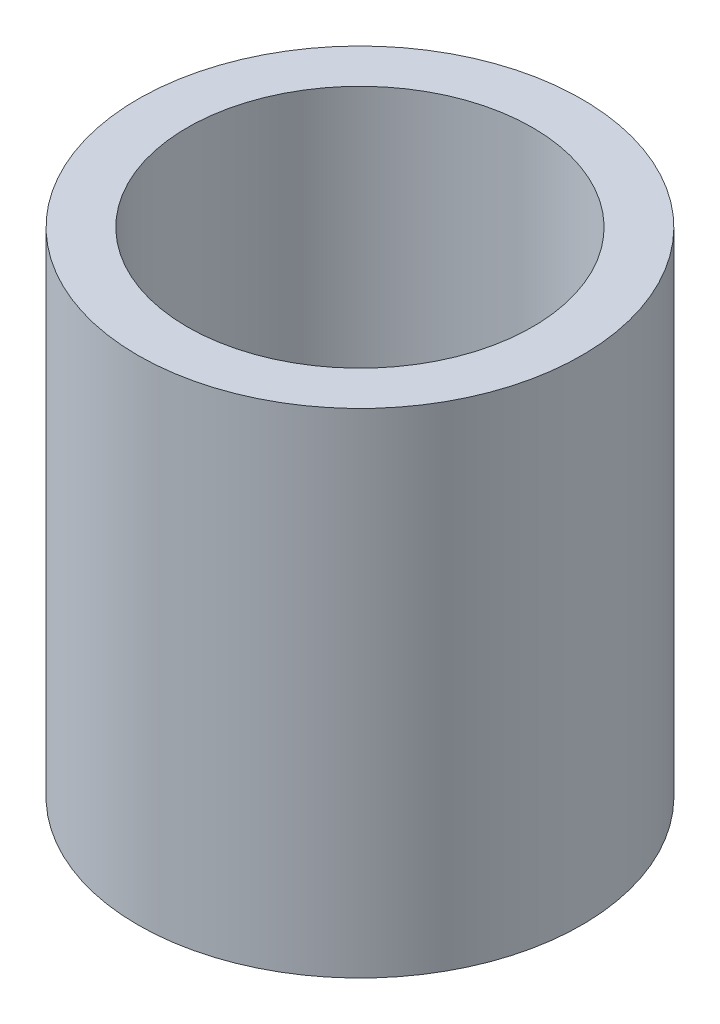
from build123d import *

# Parameters (mm, degrees)
SKETCH1_R      = 22.5
SKETCH1_R_2    = 17.5
EXTRUDE1_DEPTH = 50


with BuildPart() as part:
    # Sketch1 → Extrude1 (new body)
    with BuildSketch(Plane(origin=(0, 0, 0), x_dir=(1, 0, 0), z_dir=(0, 1, 0))):
        Circle(SKETCH1_R)
        Circle(SKETCH1_R_2, mode=Mode.SUBTRACT)
    extrude(amount=EXTRUDE1_DEPTH)


solid = part.part
